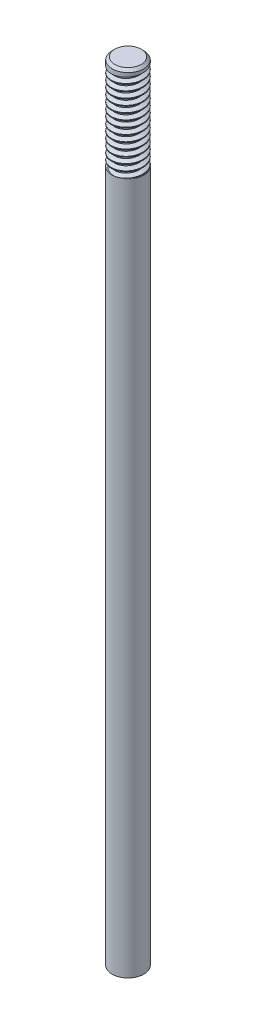
from build123d import *

# Parameters (mm, degrees)
SKETCH1_R           = 1.59385
BOSS_EXTRUDE1_DEPTH = 79.248
SKETCH2_OUTSIDE_W   = 21.064
SKETCH2_OUTSIDE_H   = 21.064
SKETCH2_OUTSIDE_R   = 1.5875
CUT_EXTRUDE1_DEPTH  = 9.525
CHAMFER1_SIZE       = 0.254
THREAD5_PITCH       = 0.635
THREAD5_TO          = 9.271


with BuildPart() as part:
    # Sketch1 → Boss-Extrude1 (new body)
    with BuildSketch(Plane(origin=(0, 0, 0), x_dir=(1, 0, 0), z_dir=(0, 1, 0))):
        with Locations(Location((0, 0, 0), (0, 0, 270))):
            Circle(SKETCH1_R)
    extrude(amount=BOSS_EXTRUDE1_DEPTH)

    # Sketch2 outside → Cut-Extrude1 (cut)
    with BuildSketch(Plane(origin=(0, 79.248, 0), x_dir=(1, 0, 0), z_dir=(0, 1, 0))):
        Rectangle(SKETCH2_OUTSIDE_W, SKETCH2_OUTSIDE_H)
        with Locations(Location((0, 0, 0), (0, 0, 270))):
            Circle(SKETCH2_OUTSIDE_R, mode=Mode.SUBTRACT)
    extrude(amount=-CUT_EXTRUDE1_DEPTH, mode=Mode.SUBTRACT)

    # Chamfer1
    chamfer1_edges = [part.edges().sort_by_distance(p)[0] for p in [
        (0, 79.248, -1.5875),
    ]]
    chamfer(chamfer1_edges, length=CHAMFER1_SIZE)

    # Thread5: arcs per turn and ends read off the stored shape
    # Thread5: the profile of Thread Profile1 profile screwed along a right-hand helix through 14.6 turns, 6 arcs to a turn; built about Z, then put on its axis
    thread5_z = Axis((0, 0, 0), (0, 0, 1))
    thread5_corners = [(1.5878, 0, -0.000173205), (1.5878, 0, 0.555798203), (1.243796169, 0, 0.357187499), (1.243796169, 0, 0.198437499)]
    with BuildLine(mode=Mode.PRIVATE) as thread5_profile:
        Line(thread5_corners[0], thread5_corners[1])
        Line(thread5_corners[1], thread5_corners[2])
        Line(thread5_corners[2], thread5_corners[3])
        Line(thread5_corners[3], thread5_corners[0])
    thread5_cap = Face(thread5_profile.wire())
    thread5_turn_angles = [0, 30, 60, 90, 120, 150, 180, 210, 240, 270, 300, 330, 360]
    thread5_turn_weights = [1, 0.8660254037844387, 1, 0.8660254037844387, 1, 0.8660254037844387, 1, 0.8660254037844387, 1, 0.8660254037844387, 1, 0.8660254037844387, 1]
    thread5_turn_rails = [Edge.make_bspline([Vector(p[0], p[1], 0).rotate(thread5_z, thread5_turn_angles[k]) / thread5_turn_weights[k] + Vector(0, 0, p[2] + THREAD5_PITCH * thread5_turn_angles[k] / 360) for k in range(13)], [0, 0, 0, 1, 1, 2, 2, 3, 3, 4, 4, 5, 5, 6, 6, 6], 2, thread5_turn_weights) for p in thread5_corners]
    thread5_turn_sides = [Face.make_surface_from_curves(thread5_turn_rails[p[0]], thread5_turn_rails[p[1]]) for p in [(0, 1), (1, 2), (2, 3), (3, 0)]]
    thread5_last_angles = [5040, 5070, 5100, 5130, 5160, 5190, 5220, 5238, 5256]
    thread5_last_weights = [1, 0.8660254037844387, 1, 0.8660254037844387, 1, 0.8660254037844387, 1, 0.9510565162951095, 1]
    thread5_last_rails = [Edge.make_bspline([Vector(p[0], p[1], 0).rotate(thread5_z, thread5_last_angles[k]) / thread5_last_weights[k] + Vector(0, 0, p[2] + THREAD5_PITCH * thread5_last_angles[k] / 360) for k in range(9)], [0, 0, 0, 1, 1, 2, 2, 3, 3, 4, 4, 4], 2, thread5_last_weights) for p in thread5_corners]
    thread5_last_sides = [Face.make_surface_from_curves(thread5_last_rails[p[0]], thread5_last_rails[p[1]]) for p in [(0, 1), (1, 2), (2, 3), (3, 0)]]
    thread5 = Plane(origin=(0, 78.994, 0), x_dir=(-1, 0, 0), z_dir=(0, -1, 0)) * split(Solid(Shell([*[p.moved(Location((0, 0, THREAD5_PITCH * i))) for i in range(14) for p in thread5_turn_sides], *thread5_last_sides, thread5_cap, thread5_cap.rotate(thread5_z, 5256).moved(Location((0, 0, THREAD5_PITCH * 5256 / 360)))])), bisect_by=Plane.XY.offset(THREAD5_TO), keep=Keep.BOTTOM, mode=Mode.PRIVATE)
    add(thread5, mode=Mode.SUBTRACT)


solid = part.part
